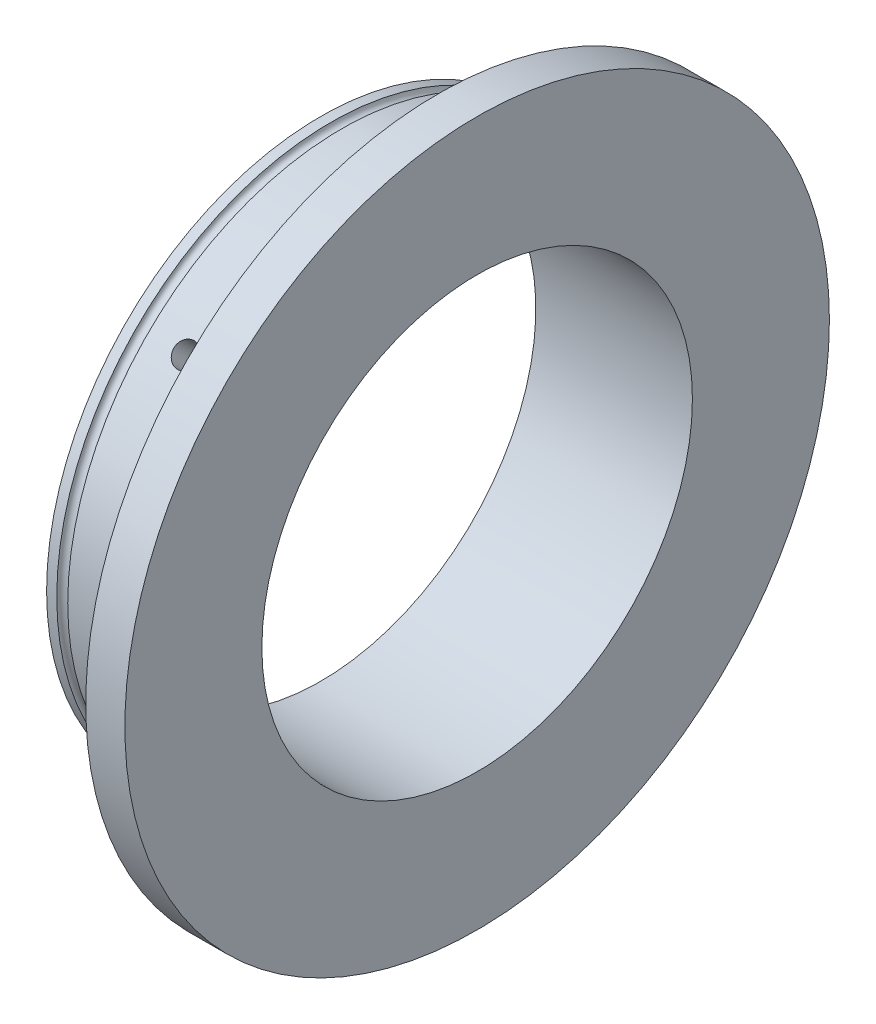
from build123d import *
from build123d.topology import SkipClean

# Parameters (mm, degrees)
SKETCH1_R           = 57.15
SKETCH1_R_2         = 34.925
BOSS_EXTRUDE1_DEPTH = 6.35
BOSS_EXTRUDE2_START = 19.05
SKETCH2_R           = 44.45
SKETCH2_R_2         = 34.925
BOSS_EXTRUDE2_DEPTH = 19.05
SKETCH3_R           = 0.889
SKETCH4_R           = 1.905
CUT_EXTRUDE1_DEPTH  = 5.08
CIRPATTERN1_COUNT   = 8


with BuildPart() as part:
    # Sketch1 → Boss-Extrude1 (new body)
    with BuildSketch(Plane(origin=(0, 0, 0), x_dir=(0, 0, -1), z_dir=(1, 0, 0))):
        Circle(SKETCH1_R)
        Circle(SKETCH1_R_2, mode=Mode.SUBTRACT)
    extrude(amount=BOSS_EXTRUDE1_DEPTH)

    # Sketch2 → Boss-Extrude2 (add)
    with SkipClean():  # the faces are left unmerged after this step: merging them gives an invalid solid
        with BuildSketch(Plane.ZY.offset(BOSS_EXTRUDE2_START)):
            Circle(SKETCH2_R)
            Circle(SKETCH2_R_2, mode=Mode.SUBTRACT)
        extrude(amount=-BOSS_EXTRUDE2_DEPTH)

    # Sketch3 → Cut-Revolve1 (revolve, cut)
    with SkipClean():  # the faces are left unmerged after this step: merging them gives an invalid solid
        with BuildSketch(Plane(origin=(0, 0, 0), x_dir=(1, 0, 0), z_dir=(0, 1, 0))):
            with Locations((-16.51, 44.45)):
                Circle(SKETCH3_R)
        revolve(axis=Axis((0, 0, 0), (-1, 0, 0)), mode=Mode.SUBTRACT)

    # Sketch4 → Cut-Extrude1 (cut)
    with SkipClean():  # the faces are left unmerged after this step: merging them gives an invalid solid
        with BuildSketch(Plane(origin=(0, 44.45, 0), x_dir=(1, 0, 0), z_dir=(0, 1, 0))):
            with Locations((-9.525, 0)):
                Circle(SKETCH4_R)
        cut_extrude1 = extrude(amount=-CUT_EXTRUDE1_DEPTH, mode=Mode.SUBTRACT)

    # CirPattern1: Cut-Extrude1 ×8 about axis
    with SkipClean():  # the faces are left unmerged after this step: merging them gives an invalid solid
        cirpattern1_axis = Axis((-19.05, 0, 0), (1, 0, 0))
        for i in range(1, CIRPATTERN1_COUNT):
            add(cut_extrude1.rotate(cirpattern1_axis, i * 360 / CIRPATTERN1_COUNT), mode=Mode.SUBTRACT)


solid = part.part
